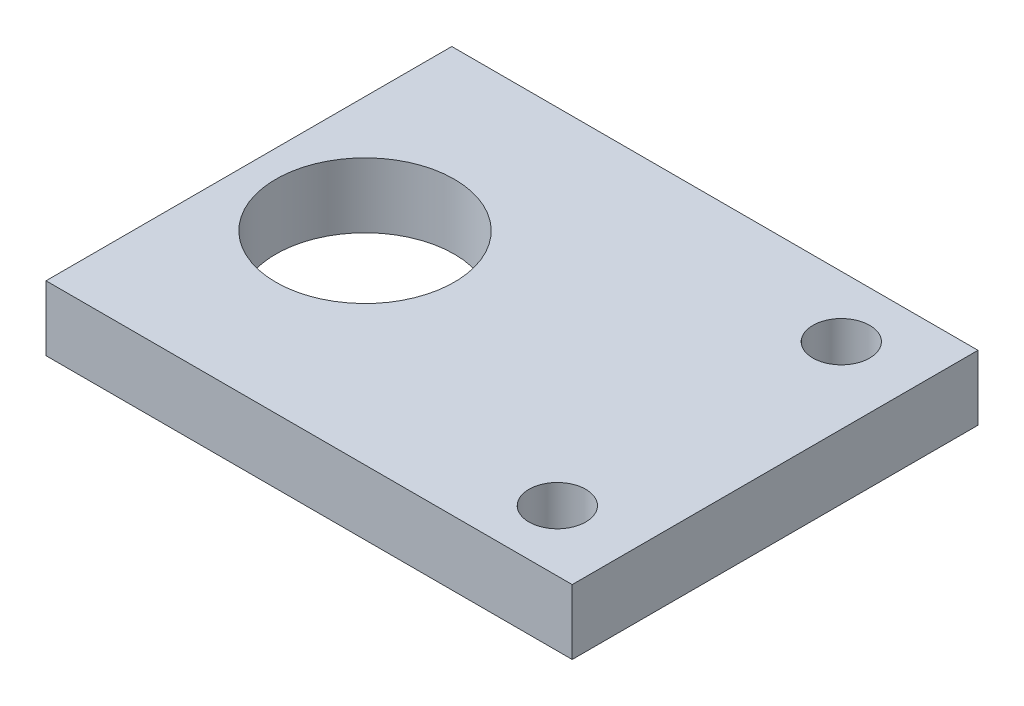
from build123d import *

# Parameters (mm, degrees)
SKETCH1_W           = 32.429536638
SKETCH1_H           = 25.007766804
SKETCH1_R           = 1.75
SKETCH1_R_2         = 5.5
BOSS_EXTRUDE1_DEPTH = 4


with BuildPart() as part:
    # Sketch1 → Boss-Extrude1 (new body)
    with BuildSketch(Plane(origin=(0, 0, 0), x_dir=(1, 0, 0), z_dir=(0, 1, 0))):
        with Locations((-9.865681564, 0)):
            Rectangle(SKETCH1_W, SKETCH1_H)
        with Locations((1.678034292, -8.75)):
            Circle(SKETCH1_R, mode=Mode.SUBTRACT)
        with Locations((1.678034292, 8.75)):
            Circle(SKETCH1_R, mode=Mode.SUBTRACT)
        with Locations((-18.921965708, 0)):
            Circle(SKETCH1_R_2, mode=Mode.SUBTRACT)
    extrude(amount=BOSS_EXTRUDE1_DEPTH)


solid = part.part
